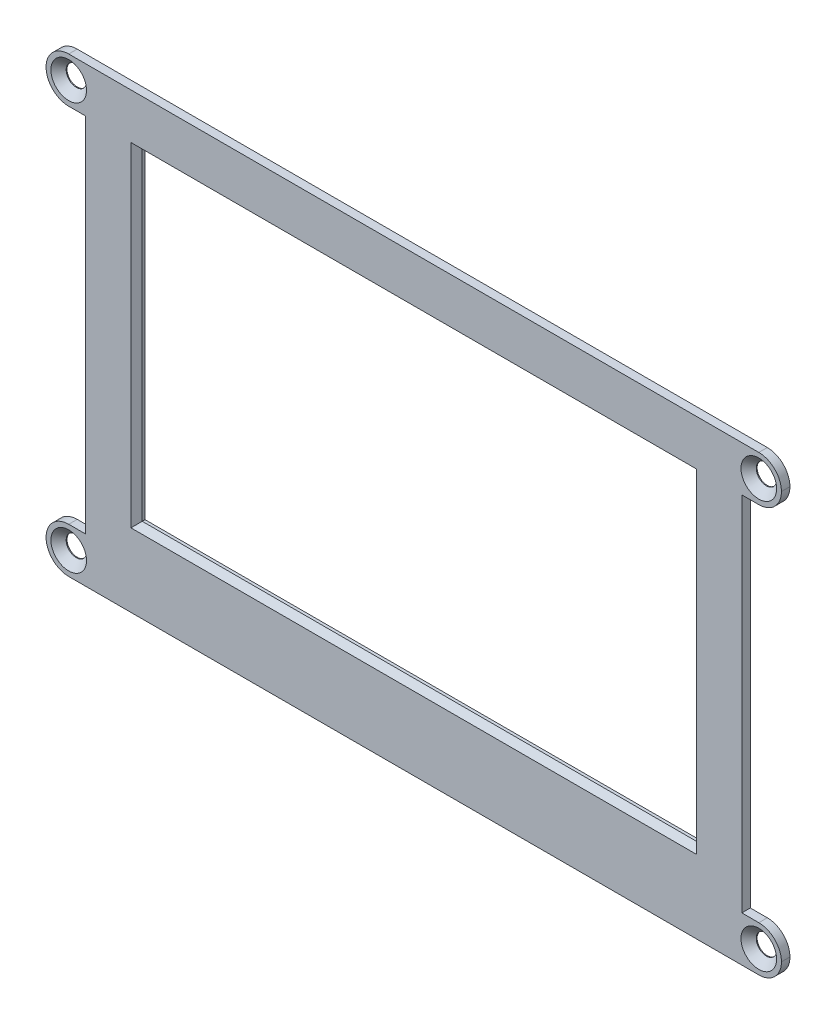
from build123d import *

# Parameters (mm, degrees)
SKETCH1_W           = 130
SKETCH1_H           = 80
BOSS_EXTRUDE1_DEPTH = 1.5
FILLET1_R           = 4
SKETCH4_W           = 98
SKETCH4_H           = 57
CUT_EXTRUDE1_DEPTH  = 6
SKETCH6_W           = 7
SKETCH6_H           = 64
CUT_EXTRUDE3_DEPTH  = 10
FILLET3_R           = 4
CHAMFER1_SIZE       = 1


with BuildPart() as part:
    # Sketch1 → Boss-Extrude1 (new body)
    with BuildSketch(Plane.XY):
        Rectangle(SKETCH1_W, SKETCH1_H)
    extrude(amount=BOSS_EXTRUDE1_DEPTH)

    # Fillet1
    fillet1_edges = [part.edges().sort_by_distance(p)[0] for p in [
        (65, -40, 0.75),
        (-65, -40, 0.75),
        (-65, 40, 0.75),
        (65, 40, 0.75),
    ]]
    fillet(fillet1_edges, radius=FILLET1_R)

    # Sketch3 → CSK for M3 Flat Countersunk Head Screw1 (revolve, cut)
    with BuildSketch(Plane(origin=(-61, 36, 1.5), x_dir=(0, -1, 0), z_dir=(1, 0, 0))):
        Polygon((0, 0), (0, 1.5), (1.8, 1.5), (1.8, 1.35), (3.15, 0), align=None)
    csk_for_m3_flat_countersunk_head_screw1 = revolve(axis=Axis((-61, 36, 7.85), (0, 0, -1)), mode=Mode.SUBTRACT)

    # Mirror1: CSK for M3 Flat Countersunk Head Screw1 across plane
    add(csk_for_m3_flat_countersunk_head_screw1.mirror(Plane(origin=(0, 0, 0), x_dir=(0, 0, 1), z_dir=(1, 0, 0))), mode=Mode.SUBTRACT)

    # Mirror2: CSK for M3 Flat Countersunk Head Screw1 across plane
    add(csk_for_m3_flat_countersunk_head_screw1.mirror(Plane.ZX), mode=Mode.SUBTRACT)

    # Mirror2 copy 1 sketch → Mirror2 copy 1 (revolve, cut)
    with BuildSketch(Plane(origin=(61, -36, 1.5), x_dir=(0, 1, 0), z_dir=(-1, 0, 0))):
        Polygon((0, 0), (0, 1.5), (1.8, 1.5), (1.8, 1.35), (3.15, 0), align=None)
    revolve(axis=Axis((61, -36, 7.85), (0, 0, -1)), mode=Mode.SUBTRACT)

    # Sketch4 → Cut-Extrude1 (cut)
    with BuildSketch(Plane.XY.offset(1.5)):
        with Locations((0, 2.45)):
            Rectangle(SKETCH4_W, SKETCH4_H)
    extrude(amount=-CUT_EXTRUDE1_DEPTH, mode=Mode.SUBTRACT)

    # Sketch6 → Cut-Extrude3 (cut)
    with BuildSketch(Plane.XY.offset(1.5)):
        with Locations((61.5, 0)):
            Rectangle(SKETCH6_W, SKETCH6_H)
    cut_extrude3 = extrude(amount=-CUT_EXTRUDE3_DEPTH, mode=Mode.SUBTRACT)

    # Mirror6: Cut-Extrude3 across plane
    add(cut_extrude3.mirror(Plane(origin=(0, 0, 0), x_dir=(0, 0, 1), z_dir=(1, 0, 0))), mode=Mode.SUBTRACT)

    # Fillet3
    fillet3_edges = [part.edges().sort_by_distance(p)[0] for p in [
        (65, -32, 0.75),
        (65, 32, 0.75),
        (-65, -32, 0.75),
        (-65, 32, 0.75),
    ]]
    fillet(fillet3_edges, radius=FILLET3_R - 0.0001)  # a hair under: the kernel refuses the full size

    # Chamfer1
    chamfer1_edges = [part.edges().sort_by_distance(p)[0] for p in [
        (-49, 2.45, 1.5),
        (0, -26.05, 1.5),
        (49, 2.45, 1.5),
        (0, 30.95, 1.5),
    ]]
    chamfer(chamfer1_edges, length=CHAMFER1_SIZE)


solid = part.part
